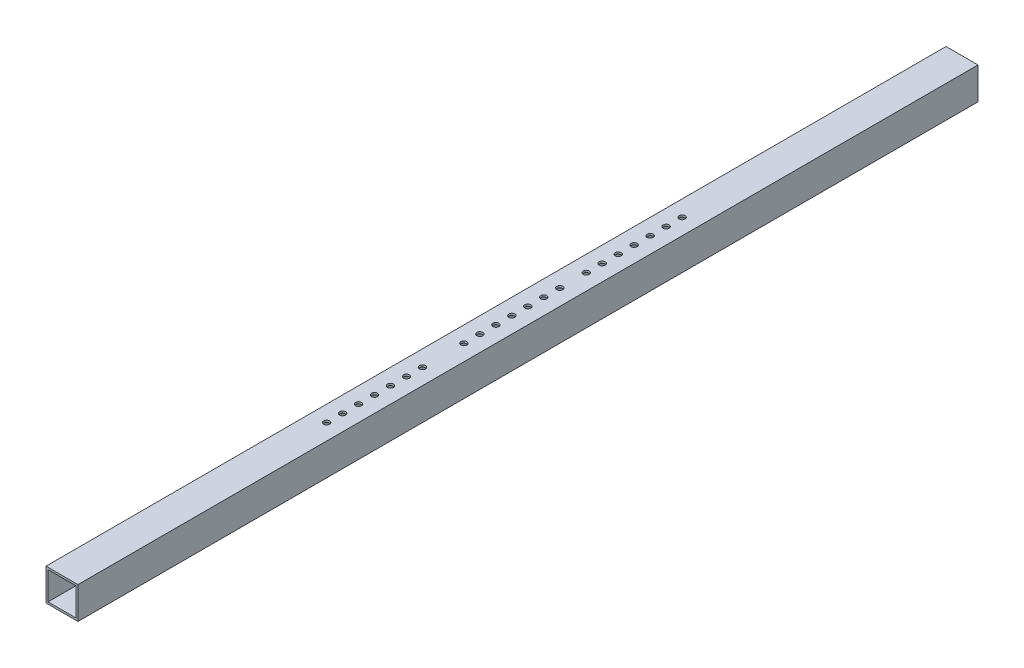
from build123d import *

# Parameters (mm, degrees)
SKETCH1_W           = 25.4
SKETCH1_H           = 25.4
SKETCH1_W_2         = 22.225
SKETCH1_H_2         = 22.225
BOSS_EXTRUDE1_DEPTH = 357.759
SKETCH2_R           = 2.38125
CUT_EXTRUDE1_DEPTH  = 359.884315736
SKETCH3_R           = 2.38125
CUT_EXTRUDE2_DEPTH  = 359.884315736


with BuildPart() as part:
    # Sketch1 → Boss-Extrude1 (new, symmetric)
    with BuildSketch(Plane.XY):
        Rectangle(SKETCH1_W, SKETCH1_H)
        Rectangle(SKETCH1_W_2, SKETCH1_H_2, mode=Mode.SUBTRACT)
    extrude(amount=BOSS_EXTRUDE1_DEPTH, both=True)

    # Sketch2 → Cut-Extrude1 (cut, through all)
    with BuildSketch(Plane.XZ.offset(12.7)):
        with Locations((0, -37.973)):
            Circle(SKETCH2_R)
        with Locations((0, -25.273)):
            Circle(SKETCH2_R)
        with Locations((0, -12.573)):
            Circle(SKETCH2_R)
        with Locations((0, 0.127)):
            Circle(SKETCH2_R)
        with Locations((0, 12.827)):
            Circle(SKETCH2_R)
        with Locations((0, 25.527)):
            Circle(SKETCH2_R)
        with Locations((0, 38.227)):
            Circle(SKETCH2_R)
    extrude(amount=-CUT_EXTRUDE1_DEPTH, mode=Mode.SUBTRACT)

    # Sketch3 → Cut-Extrude2 (cut, through all)
    with BuildSketch(Plane.XZ.offset(12.7)):
        with Locations((0, 71.18135497)):
            Circle(SKETCH3_R)
        with Locations((0, 83.88135497)):
            Circle(SKETCH3_R)
        with Locations((0, 96.58135497)):
            Circle(SKETCH3_R)
        with Locations((0, 121.98135497)):
            Circle(SKETCH3_R)
        with Locations((0, 134.68135497)):
            Circle(SKETCH3_R)
        with Locations((0, 147.38135497)):
            Circle(SKETCH3_R)
        with Locations((0, 109.28135497)):
            Circle(SKETCH3_R)
        with Locations((0, -59.018644472)):
            Circle(SKETCH3_R)
        with Locations((0, -71.718644472)):
            Circle(SKETCH3_R)
        with Locations((0, -84.418644472)):
            Circle(SKETCH3_R)
        with Locations((0, -97.118644472)):
            Circle(SKETCH3_R)
        with Locations((0, -109.818644472)):
            Circle(SKETCH3_R)
        with Locations((0, -122.518644472)):
            Circle(SKETCH3_R)
        with Locations((0, -135.218644472)):
            Circle(SKETCH3_R)
    extrude(amount=-CUT_EXTRUDE2_DEPTH, mode=Mode.SUBTRACT)


solid = part.part
